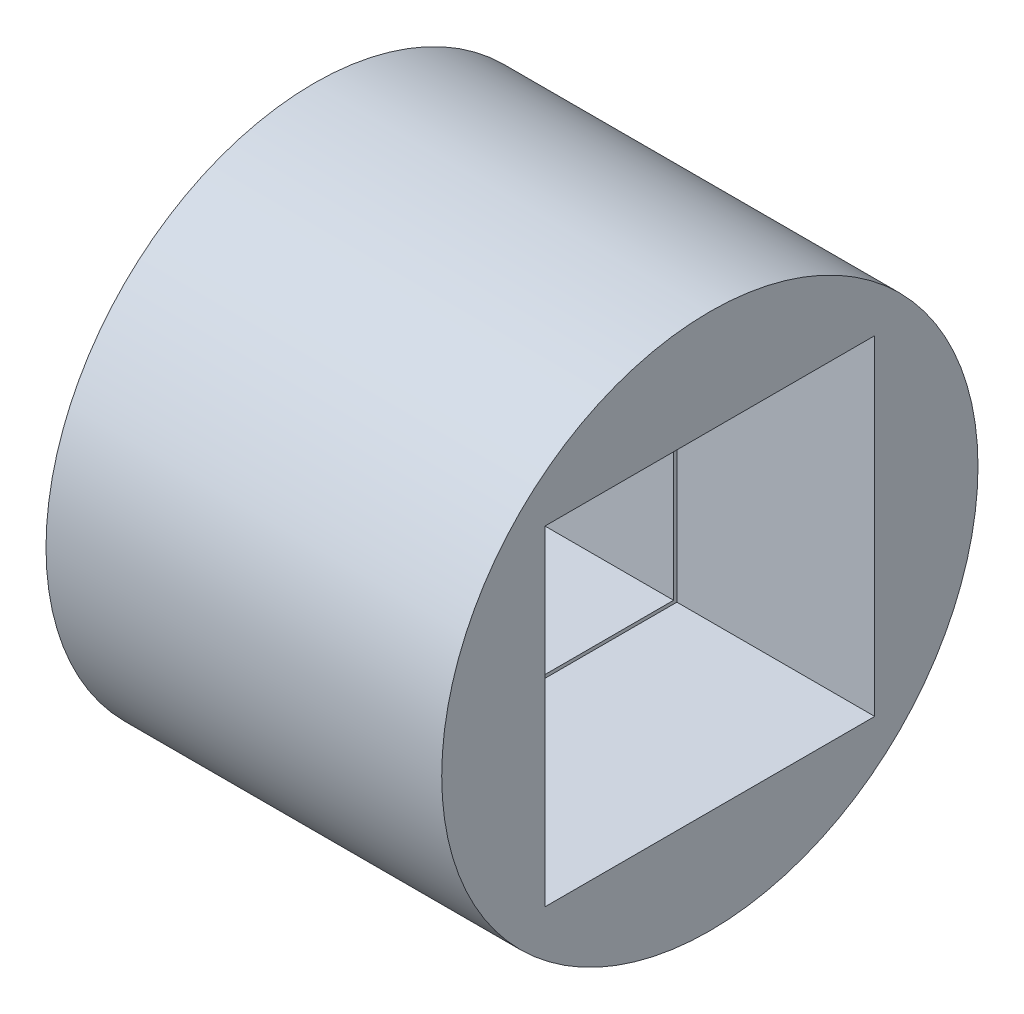
from build123d import *

# Parameters (mm, degrees)
SKETCH_1_R      = 4.065789027
SKETCH_1_W      = 5
SKETCH_1_H      = 5
EXTRUDE_1_DEPTH = 3
EXTRUDE_START   = 3
SKETCH_2_R      = 4.065789027
SKETCH_2_W      = 4.9
SKETCH_2_H      = 4.9
EXTRUDE_2_DEPTH = 3


with BuildPart() as part:
    # 草图1 → 凸台-拉伸1 (new body)
    with BuildSketch(Plane(origin=(0, 0, 0), x_dir=(0, 0, -1), z_dir=(1, 0, 0))):
        Circle(SKETCH_1_R)
        Rectangle(SKETCH_1_W, SKETCH_1_H, mode=Mode.SUBTRACT)
    extrude(amount=EXTRUDE_1_DEPTH)

    # 草图2 → 凸台-拉伸2 (add)
    with BuildSketch(Plane.ZY.offset(EXTRUDE_START)):
        Circle(SKETCH_2_R)
        Rectangle(SKETCH_2_W, SKETCH_2_H, mode=Mode.SUBTRACT)
    extrude(amount=-EXTRUDE_2_DEPTH)


solid = part.part
